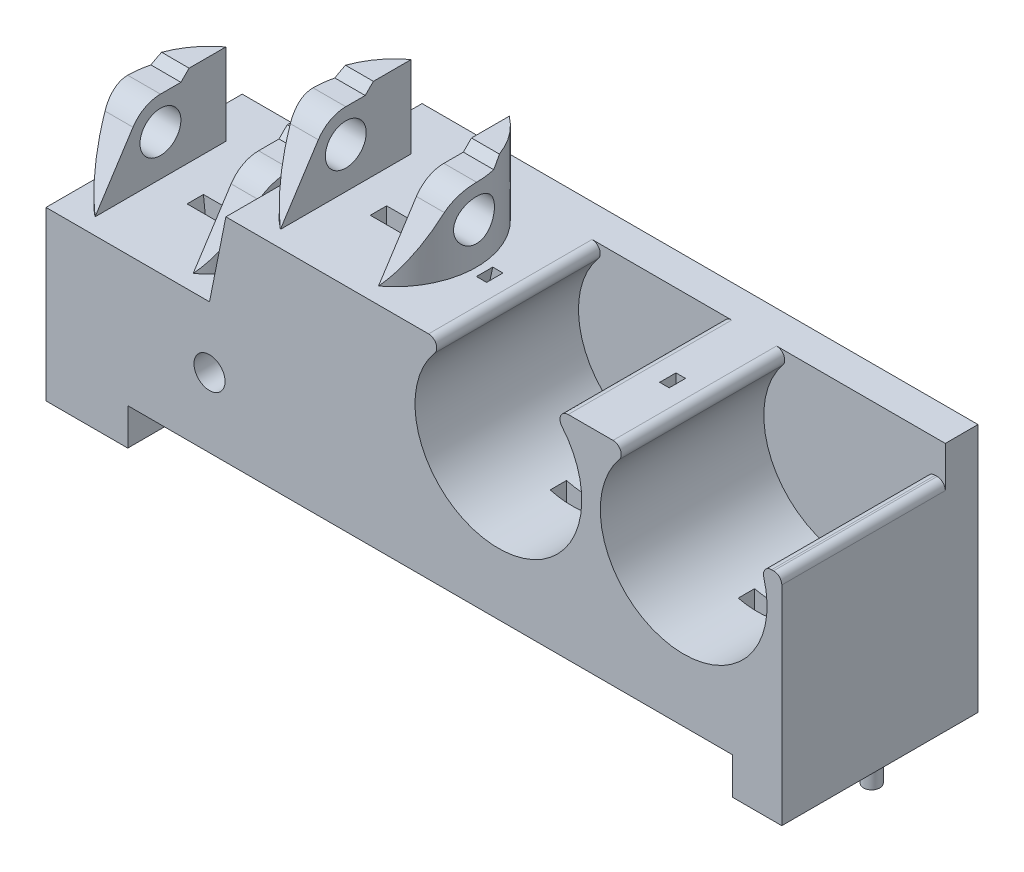
from build123d import *

# Parameters (mm, degrees)
SKETCH2_W                      = 114.3
SKETCH2_H                      = 142.875
BOSS_EXTRUDE2_DEPTH            = 30.48
FILLET1_SIZE                   = 25.4
FILLET1_SIZE_2                 = 71.501
BOSS_EXTRUDE3_DEPTH            = 11.43
CUT_EXTRUDE2_DEPTH             = 25.4
FILLET2_R                      = 1.27
SKETCH7_W                      = 27.94
SKETCH7_H                      = 30.48
CUT_EXTRUDE4_DEPTH             = 12.7
BOSS_EXTRUDE4_DEPTH            = 11.43
CUT_EXTRUDE6_DEPTH             = 25.4
CUT_EXTRUDE7_DEPTH             = 171.262283535
CUT_EXTRUDE7_DEPTH_BACK        = 171.262283535
SKETCH11_R                     = 3.175
CUT_EXTRUDE8_REACH             = 185.225
SKETCH12_R                     = 3.175
CUT_EXTRUDE8_DIRECTION_2_DEPTH = 184.224735996
CHAMFER1_SIZE2                 = 12.7
CHAMFER1_SIZE                  = 2.54
SKETCH13_W                     = 7.62
SKETCH13_H                     = 5.08
CUT_EXTRUDE9_DEPTH             = 25.4
FILLET4_R                      = 1.27
CUT_EXTRUDE10_DEPTH            = 195.431359314
CHAMFER2_SIZE                  = 12.7
CUT_EXTRUDE11_REACH            = 196.431
SKETCH15_R                     = 3.175
BOSS_EXTRUDE5_DEPTH            = 1.27
CHAMFER3_SIZE                  = 1.27
BOSS_EXTRUDE6_DEPTH            = 1.27
CHAMFER4_SIZE                  = 1.27
FILLET5_R                      = 15.24
CUT_EXTRUDE12_DEPTH            = 16.51
SKETCH20_W                     = 2.54
SKETCH20_H                     = 2.54
CUT_EXTRUDE13_DEPTH            = 171.777226453
FILLET6_R                      = 1.27
CUT_EXTRUDE14_DEPTH            = 1.27
CUT_EXTRUDE14_DEPTH_BACK       = 1.27
SKETCH21_W                     = 5.08
SKETCH21_H                     = 33.02
SKETCH21_H_2                   = 10.040791179
SKETCH21_H_3                   = 10.09120709
SKETCH21_W_2                   = 7.62
SKETCH21_H_4                   = 1.402013576
SKETCH21_W_3                   = 1.485233779
FILLET7_R                      = 11.43
SKETCH22_R                     = 1.27
CUT_EXTRUDE15_DEPTH            = 12.7
CUT_EXTRUDE16_DEPTH            = 196.440786647
CUT_EXTRUDE16_DEPTH_BACK       = 196.440786647
SKETCH23_R                     = 2.413
SKETCH24_W                     = 12.7
SKETCH24_H                     = 30.48
BOSS_EXTRUDE7_DEPTH            = 25.4
SKETCH25_R                     = 2.54
CUT_EXTRUDE17_DEPTH            = 178.14615249
CUT_EXTRUDE18_DEPTH            = 104.14
CUT_EXTRUDE18_DEPTH_BACK       = 43.18
SKETCH27_W                     = 143.457929344
SKETCH27_H                     = 100.176079989
SKETCH28_R                     = 1.27
BOSS_EXTRUDE8_DEPTH            = 5.08


# Some blends are built 0.0001 mm under size
with BuildPart() as part:
    # Sketch2 → Boss-Extrude2 (new body)
    with BuildSketch(Plane.XY):
        with Locations((57.15, 71.4375)):
            Rectangle(SKETCH2_W, SKETCH2_H)
    extrude(amount=BOSS_EXTRUDE2_DEPTH)

    # Fillet1
    # an asymmetric fillet: 71.501, 25.4 mm, written as the material it takes off along each edge
    with BuildSketch(Plane(origin=(0, 0, -178.7525), x_dir=(1, 0, 0), z_dir=(0, 0, 1))) as fillet1_piece_1:
        with BuildLine():
            Bezier((FILLET1_SIZE, 0), (0, 0), (0, FILLET1_SIZE_2), weights=[1, 0.707106781, 1])
            Line((0, FILLET1_SIZE_2), (0, 0))
            Line((0, 0), (FILLET1_SIZE, 0))
        make_face()
    extrude(amount=387.985, mode=Mode.SUBTRACT)

    # Sketch3 → Boss-Extrude3 (add)
    with BuildSketch(Plane(origin=(0, 142.875, 0), x_dir=(1, 0, 0), z_dir=(0, 1, 0))):
        with BuildLine():
            Line((33.866582, -7.62), (33.866582, -27.94))
            ThreePointArc((33.866582, -27.94), (28.786582, -17.78), (33.866582, -7.62))
        make_face()
        with BuildLine():
            Line((49.106582, -7.62), (49.106582, -27.94))
            ThreePointArc((49.106582, -27.94), (54.186582, -17.78), (49.106582, -7.62))
        make_face()
    extrude(amount=BOSS_EXTRUDE3_DEPTH)

    # Sketch5 → Cut-Extrude2 (cut)
    with BuildSketch(Plane.XY.offset(30.48)):
        with BuildLine():
            Line((62.653333333, 142.875), (77.893333333, 142.875))
            ThreePointArc((77.893333333, 142.875), (70.273333333, 119.445231961), (62.653333333, 142.875))
        make_face()
        with BuildLine():
            Line((91.44, 143.032457663), (106.68, 143.032457663))
            ThreePointArc((106.68, 143.032457663), (99.06, 119.602689625), (91.44, 143.032457663))
        make_face()
    extrude(amount=-CUT_EXTRUDE2_DEPTH, mode=Mode.SUBTRACT)

    # Fillet2
    fillet2_edges = [part.edges().sort_by_distance(p)[0] for p in [
        (77.893333333, 142.875, 17.78),
        (62.653333333, 142.875, 17.78),
        (91.228104508, 142.875, 17.78),
    ]]
    fillet(fillet2_edges, radius=FILLET2_R)

    # Sketch7 → Cut-Extrude4 (cut)
    with BuildSketch(Plane(origin=(0, 142.875, 0), x_dir=(1, 0, 0), z_dir=(0, 1, 0))):
        with Locations((13.97, -15.24)):
            Rectangle(SKETCH7_W, SKETCH7_H)
    extrude(amount=-CUT_EXTRUDE4_DEPTH, mode=Mode.SUBTRACT)

    # Sketch8 → Boss-Extrude4 (add)
    with BuildSketch(Plane(origin=(0, 130.175, 0), x_dir=(1, 0, 0), z_dir=(0, 1, 0))):
        with BuildLine():
            Line((5.08, -7.62), (5.08, -27.94))
            ThreePointArc((5.08, -27.94), (0, -17.78), (5.08, -7.62))
        make_face()
        with BuildLine():
            Line((20.32, -7.62), (20.32, -27.94))
            ThreePointArc((20.32, -27.94), (25.4, -17.78), (20.32, -7.62))
        make_face()
    extrude(amount=BOSS_EXTRUDE4_DEPTH)

    # Sketch10 → Cut-Extrude6 (cut)
    with BuildSketch(Plane.XY.offset(30.48)):
        Polygon((63.5, 109.855), (12.7, 109.855), (12.7, 61.2775), (38.1, 12.7), (63.5, 12.7), (63.5, 94.615), (106.68, 94.615), (106.68, 109.855), align=None)
    extrude(amount=-CUT_EXTRUDE6_DEPTH, mode=Mode.SUBTRACT)

    # Sketch11 → Cut-Extrude7 (cut, two sides: drawn at the far end of the back side and taken through both)
    with BuildSketch(Plane.ZY.offset(-49.106582).offset(-CUT_EXTRUDE7_DEPTH_BACK)):
        with Locations((17.78, 149.225)):
            Circle(SKETCH11_R)
        with BuildLine():
            Line((22.044917923, 151.984868677), (27.94, 142.875))
            Line((27.94, 142.875), (27.94, 154.305))
            Line((27.94, 154.305), (17.78, 154.305))
            ThreePointArc((17.78, 154.305), (20.207577715, 153.687428312), (22.044917923, 151.984868677))
        make_face()
    extrude(amount=CUT_EXTRUDE7_DEPTH + CUT_EXTRUDE7_DEPTH_BACK, mode=Mode.SUBTRACT)

    # Cut-Extrude8: up to this face of the body (flat: up to its plane)
    cut_extrude8_end = Plane(part.part.faces().sort_by_distance((27.94, 136.525, 15.24))[0])
    # Sketch12 → Cut-Extrude8 (cut, up to the picked face)
    with BuildSketch(Plane.ZY.offset(-20.32), mode=Mode.PRIVATE) as cut_extrude8_sk1:
        with Locations((17.78, 136.525)):
            Circle(SKETCH12_R)
    cut_extrude8_tool1 = split(extrude(cut_extrude8_sk1.sketch, amount=-CUT_EXTRUDE8_REACH, mode=Mode.PRIVATE), bisect_by=cut_extrude8_end, keep=Keep.BOTH, mode=Mode.PRIVATE)
    # Sketch12 → Cut-Extrude8 (cut, up to the picked face)
    with BuildSketch(Plane.ZY.offset(-20.32), mode=Mode.PRIVATE) as cut_extrude8_sk2:
        with BuildLine():
            Line((22.044917923, 139.284868677), (27.94, 130.175))
            Line((27.94, 130.175), (27.94, 141.605))
            Line((27.94, 141.605), (17.78, 141.605))
            ThreePointArc((17.78, 141.605), (20.207577715, 140.987428312), (22.044917923, 139.284868677))
        make_face()
    cut_extrude8_tool2 = split(extrude(cut_extrude8_sk2.sketch, amount=-CUT_EXTRUDE8_REACH, mode=Mode.PRIVATE), bisect_by=cut_extrude8_end, keep=Keep.BOTH, mode=Mode.PRIVATE)
    add(cut_extrude8_tool1.solids().sort_by(Axis((20.32, 136.525, 17.78), (1, 0, 0)))[0], mode=Mode.SUBTRACT)
    add(cut_extrude8_tool2.solids().sort_by(Axis((20.32, 137.885407, 25.333291), (1, 0, 0)))[0], mode=Mode.SUBTRACT)

    # Sketch12 → Cut-Extrude8 direction 2 (cut)
    with BuildSketch(Plane.ZY.offset(-20.32)):
        with Locations((17.78, 136.525)):
            Circle(SKETCH12_R)
        with BuildLine():
            Line((22.044917923, 139.284868677), (27.94, 130.175))
            Line((27.94, 130.175), (27.94, 141.605))
            Line((27.94, 141.605), (17.78, 141.605))
            ThreePointArc((17.78, 141.605), (20.207577715, 140.987428312), (22.044917923, 139.284868677))
        make_face()
    extrude(amount=CUT_EXTRUDE8_DIRECTION_2_DEPTH, mode=Mode.SUBTRACT)

    # Chamfer1
    chamfer1_edges = [part.edges().sort_by_distance(p)[0] for p in [
        (27.94, 130.175, 15.24),
    ]]
    chamfer1_side = [part.faces().sort_by_distance(p)[0] for p in [
        (27.8892, 130.175, 15.24),
    ]]
    chamfer(chamfer1_edges, length=CHAMFER1_SIZE - 0.0001, length2=CHAMFER1_SIZE2 - 0.0001, reference=chamfer1_side[0])  # a hair under: the kernel refuses the full size

    # Sketch13 → Cut-Extrude9 (cut)
    with BuildSketch(Plane.XY.offset(30.48)):
        with Locations((110.49, 140.335)):
            Rectangle(SKETCH13_W, SKETCH13_H)
    extrude(amount=-CUT_EXTRUDE9_DEPTH, mode=Mode.SUBTRACT)

    # Fillet4
    fillet4_edges = [part.edges().sort_by_distance(p)[0] for p in [
        (110.907625096, 137.795, 17.78),
        (114.3, 137.795, 17.78),
    ]]
    fillet(fillet4_edges, radius=FILLET4_R)

    # Sketch14 → Cut-Extrude10 (cut, through all)
    with BuildSketch(Plane.XY.offset(30.48)):
        Polygon((114.3, 12.7), (81.28, 12.7), (81.28, 26.67), (111.76, 26.67), (111.76, 69.85), (81.28, 69.85), (81.28, 83.82), (114.3, 83.82), align=None)
    extrude(amount=-CUT_EXTRUDE10_DEPTH, mode=Mode.SUBTRACT)

    # Chamfer2
    chamfer2_edges = [part.edges().sort_by_distance(p)[0] for p in [
        (81.28, 76.835, 30.48),
        (81.28, 19.685, 30.48),
    ]]
    chamfer(chamfer2_edges, length=CHAMFER2_SIZE)

    # Cut-Extrude11: up to this face of the body (flat: up to its plane)
    cut_extrude11_end = Plane(part.part.faces().sort_by_distance((59.69, 109.855, 17.78))[0])
    # Sketch15 → Cut-Extrude11 (cut, up to the picked face)
    with BuildSketch(Plane.XZ, mode=Mode.PRIVATE) as cut_extrude11_sk1:
        with Locations(Location((99.06, 17.78, 0), (0, 0, 270))):
            Circle(SKETCH15_R)
    cut_extrude11_tool1 = split(extrude(cut_extrude11_sk1.sketch, amount=-CUT_EXTRUDE11_REACH, mode=Mode.PRIVATE), bisect_by=cut_extrude11_end, keep=Keep.BOTH, mode=Mode.PRIVATE)
    add(cut_extrude11_tool1.solids().sort_by(Axis((99.06, 0, 17.78), (0, 1, 0)))[0], mode=Mode.SUBTRACT)

    # Sketch16 → Boss-Extrude5 (add)
    with BuildSketch(Plane(origin=(0, 141.605, 0), x_dir=(1, 0, 0), z_dir=(0, 1, 0))):
        with BuildLine():
            Line((0.406992957, -14.590646171), (5.08, -14.605))
            Line((5.08, -14.605), (5.08, -7.62))
            ThreePointArc((5.08, -7.62), (2.151092977, -10.708185479), (0.406992957, -14.590646171))
        make_face()
        with BuildLine():
            Line((20.32, -14.605), (24.996722124, -14.605))
            ThreePointArc((24.996722124, -14.605), (23.253033275, -10.714344425), (20.32, -7.62))
            Line((20.32, -7.62), (20.32, -14.605))
        make_face()
    extrude(amount=BOSS_EXTRUDE5_DEPTH)

    # Chamfer3
    chamfer3_edges = [part.edges().sort_by_distance(p)[0] for p in [
        (22.658361062, 142.875, 14.605),
        (2.743496479, 142.875, 14.597823086),
    ]]
    chamfer(chamfer3_edges, length=CHAMFER3_SIZE - 0.0001)  # a hair under: the kernel refuses the full size

    # Sketch17 → Boss-Extrude6 (add)
    with BuildSketch(Plane(origin=(0, 154.305, 0), x_dir=(1, 0, 0), z_dir=(0, 1, 0))):
        with BuildLine():
            Line((29.150536334, -14.761394806), (33.866582, -14.761394806))
            Line((33.866582, -14.761394806), (33.866582, -7.62))
            ThreePointArc((33.866582, -7.62), (30.888902084, -10.781487273), (29.150536334, -14.761394806))
        make_face()
        with BuildLine():
            Line((49.106582, -14.761394806), (53.822627666, -14.761394806))
            ThreePointArc((53.822627666, -14.761394806), (52.084261916, -10.781487273), (49.106582, -7.62))
            Line((49.106582, -7.62), (49.106582, -14.761394806))
        make_face()
    extrude(amount=BOSS_EXTRUDE6_DEPTH)

    # Chamfer4
    chamfer4_edges = [part.edges().sort_by_distance(p)[0] for p in [
        (51.464604833, 155.575, 14.761394806),
        (31.508559167, 155.575, 14.761394806),
    ]]
    chamfer(chamfer4_edges, length=CHAMFER4_SIZE - 0.0001)  # a hair under: the kernel refuses the full size

    # Fillet5
    fillet5_edges = [part.edges().sort_by_distance(p)[0] for p in [
        (111.76, 48.26, 30.48),
    ]]
    fillet(fillet5_edges, radius=FILLET5_R)

    # Sketch19 → Cut-Extrude12 (cut)
    with BuildSketch(Plane.XY.offset(30.48)):
        Polygon((81.28, 52.07), (111.76, 52.07), (111.76, 57.15), (81.28, 57.15), (69.85, 57.15), (69.85, 52.07), align=None)
    extrude(amount=-CUT_EXTRUDE12_DEPTH, mode=Mode.SUBTRACT)

    # Sketch20 → Cut-Extrude13 (cut, through all)
    with BuildSketch(Plane.ZY.offset(-63.5)):
        with Locations((19.05, 39.37)):
            Rectangle(SKETCH20_W, SKETCH20_H)
    extrude(amount=-CUT_EXTRUDE13_DEPTH, mode=Mode.SUBTRACT)

    # Fillet6
    fillet6_edges = [part.edges().sort_by_distance(p)[0] for p in [
        (63.5, 38.1, 19.05),
    ]]
    fillet(fillet6_edges, radius=FILLET6_R)

    # Sketch21 → Cut-Extrude14 (cut, two sides: drawn at the far end of the back side and taken through both)
    with BuildSketch(Plane.XY.offset(17.78).offset(-CUT_EXTRUDE14_DEPTH_BACK)):
        Polygon((12.7, 109.855), (10.485930724, 130.175), (15.565930724, 130.175), (17.78, 109.855), align=None)
        Polygon((55.429725371, 142.875), (50.86041281, 121.653709764), (50.86041281, 109.855), (52.449738918, 109.855), (52.449738918, 121.653709764), (57.019051479, 142.875), align=None)
        with Locations((41.486582, 126.365)):
            Rectangle(SKETCH21_W, SKETCH21_H)
        with Locations((69.426582, 114.87539559)):
            Rectangle(SKETCH21_W, SKETCH21_H_2)
        with Locations((98.636582, 114.900603545)):
            Rectangle(SKETCH21_W, SKETCH21_H_3)
        with Locations((110.49, 102.445426643)):
            Rectangle(SKETCH21_W_2, SKETCH21_H_4)
        with Locations((84.636338767, 126.365)):
            Rectangle(SKETCH21_W_3, SKETCH21_H)
    extrude(amount=CUT_EXTRUDE14_DEPTH + CUT_EXTRUDE14_DEPTH_BACK, mode=Mode.SUBTRACT)

    # Fillet7
    fillet7_edges = [part.edges().sort_by_distance(p)[0] for p in [
        (63.5, 94.615, 17.78),
    ]]
    fillet(fillet7_edges, radius=FILLET7_R)

    # Sketch22 → Cut-Extrude15 (cut)
    with BuildSketch(Plane(origin=(0, 12.7, 0), x_dir=(1, 0, 0), z_dir=(0, 1, 0))):
        with Locations(Location((43.18, -11.908276952, 0), (0, 0, 180))):
            Circle(SKETCH22_R)
        with Locations(Location((48.26, -11.908276952, 0), (0, 0, 180))):
            Circle(SKETCH22_R)
        with Locations(Location((53.34, -11.908276952, 0), (0, 0, 180))):
            Circle(SKETCH22_R)
        with Locations(Location((58.42, -11.908276952, 0), (0, 0, 180))):
            Circle(SKETCH22_R)
        with Locations(Location((43.18, -22.068276952, 0), (0, 0, 180))):
            Circle(SKETCH22_R)
        with Locations(Location((48.26, -22.068276952, 0), (0, 0, 180))):
            Circle(SKETCH22_R)
        with Locations(Location((53.34, -22.068276952, 0), (0, 0, 180))):
            Circle(SKETCH22_R)
        with Locations(Location((58.42, -22.068276952, 0), (0, 0, 180))):
            Circle(SKETCH22_R)
    extrude(amount=-CUT_EXTRUDE15_DEPTH, mode=Mode.SUBTRACT)

    # Sketch23 → Cut-Extrude16 (cut, two sides: drawn at the far end of the back side and taken through both)
    with BuildSketch(Plane(origin=(0, 0, 0), x_dir=(-1, 0, 0), z_dir=(0, 0, -1)).offset(-CUT_EXTRUDE16_DEPTH_BACK)):
        with Locations((-25.4, 120.65)):
            Circle(SKETCH23_R)
        with Locations((-19.05, 25.4)):
            Circle(SKETCH23_R)
        with Locations((-82.55, 6.35)):
            Circle(SKETCH23_R)
    extrude(amount=CUT_EXTRUDE16_DEPTH + CUT_EXTRUDE16_DEPTH_BACK, mode=Mode.SUBTRACT)

    # Sketch24 → Boss-Extrude7 (add)
    with BuildSketch(Plane.XZ):
        with Locations((31.75, 15.24)):
            Rectangle(SKETCH24_W, SKETCH24_H)
        with Locations((72.695229231, 15.24)):
            Rectangle(SKETCH24_W, SKETCH24_H)
    extrude(amount=BOSS_EXTRUDE7_DEPTH)

    # Sketch25 → Cut-Extrude17 (cut, through all)
    with BuildSketch(Plane(origin=(79.045229231, 0, 0), x_dir=(0, 0, -1), z_dir=(1, 0, 0))):
        with Locations((-15.24, -12.7)):
            Circle(SKETCH25_R)
    extrude(amount=-CUT_EXTRUDE17_DEPTH, mode=Mode.SUBTRACT)

    # Sketch27 → Cut-Extrude18 (cut, two sides: drawn at the far end of the back side and taken through both)
    with BuildSketch(Plane(origin=(0, 0, 0), x_dir=(1, 0, 0), z_dir=(0, 1, 0)).offset(-CUT_EXTRUDE18_DEPTH_BACK)):
        with Locations((68.63275208, 14.348076665)):
            Rectangle(SKETCH27_W, SKETCH27_H)
    extrude(amount=CUT_EXTRUDE18_DEPTH + CUT_EXTRUDE18_DEPTH_BACK, mode=Mode.SUBTRACT)

    # Sketch28 → Boss-Extrude8 (add)
    with BuildSketch(Plane.XZ.offset(-104.14)):
        with Locations(Location((6.35, 12.7, 0), (0, 0, 90))):
            Circle(SKETCH28_R)
        with Locations(Location((110.49, 12.7, 0), (0, 0, 90))):
            Circle(SKETCH28_R)
    extrude(amount=BOSS_EXTRUDE8_DEPTH)


solid = part.part
